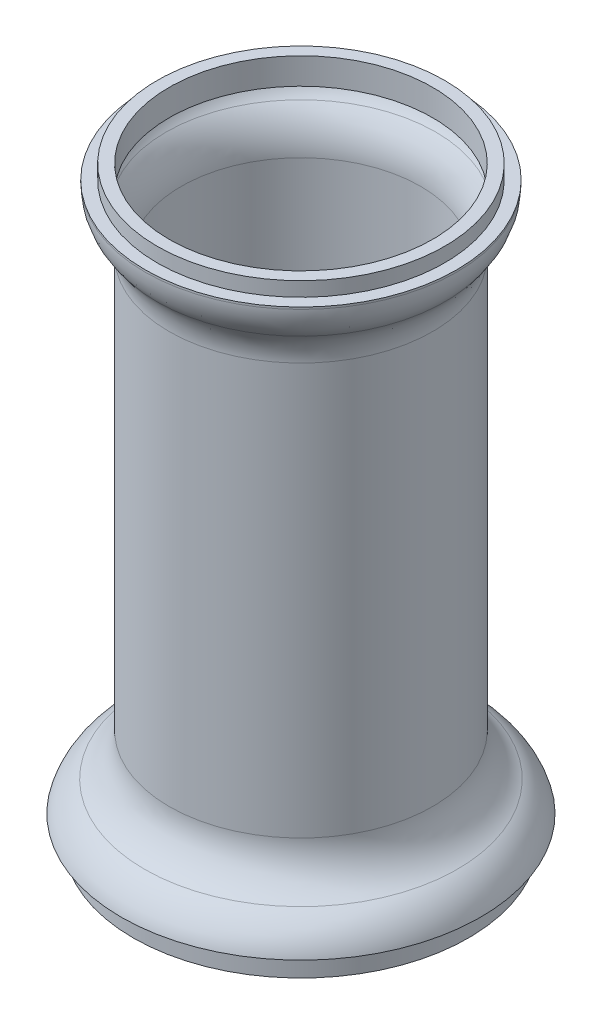
from build123d import *

# Parameters (mm, degrees)
SKETCH1_R           = 35
BOSS_EXTRUDE1_DEPTH = 5
SKETCH3_R           = 37.5
BOSS_EXTRUDE2_DEPTH = 5
SKETCH4_R           = 27.5
BOSS_EXTRUDE5_DEPTH = 104.5
SKETCH5_R           = 32.5
BOSS_EXTRUDE6_DEPTH = 5
SKETCH6_R           = 30
BOSS_EXTRUDE7_DEPTH = 3
FILLET1_R           = 10
FILLET2_R           = 10


# Read off the part's stored shape, not the designer's step: Shell1
with BuildPart() as part:
    # Sketch1 → Boss-Extrude1 (new body)
    with BuildSketch(Plane(origin=(0, 0, 0), x_dir=(1, 0, 0), z_dir=(0, 1, 0))):
        with Locations(Location((0, 0, 0), (0, 0, 270))):
            Circle(SKETCH1_R)
    extrude(amount=BOSS_EXTRUDE1_DEPTH)

    # Sketch3 → Boss-Extrude2 (add)
    with BuildSketch(Plane(origin=(0, 5, 0), x_dir=(1, 0, 0), z_dir=(0, 1, 0))):
        with Locations(Location((0, 0, 0), (0, 0, 270))):
            Circle(SKETCH3_R)
    extrude(amount=BOSS_EXTRUDE2_DEPTH)

    # Sketch4 → Boss-Extrude5 (add)
    with BuildSketch(Plane(origin=(0, 10, 0), x_dir=(1, 0, 0), z_dir=(0, 1, 0))):
        with Locations(Location((0, 0, 0), (0, 0, 270))):
            Circle(SKETCH4_R)
    extrude(amount=BOSS_EXTRUDE5_DEPTH)

    # Sketch5 → Boss-Extrude6 (add)
    with BuildSketch(Plane(origin=(0, 114.5, 0), x_dir=(1, 0, 0), z_dir=(0, 1, 0))):
        with Locations(Location((0, 0, 0), (0, 0, 270))):
            Circle(SKETCH5_R)
    extrude(amount=BOSS_EXTRUDE6_DEPTH)

    # Sketch6 → Boss-Extrude7 (add)
    with BuildSketch(Plane(origin=(0, 119.5, 0), x_dir=(1, 0, 0), z_dir=(0, 1, 0))):
        with Locations(Location((0, 0, 0), (0, 0, 270))):
            Circle(SKETCH6_R)
    extrude(amount=BOSS_EXTRUDE7_DEPTH)

    # Fillet1
    # the kernel refuses this fillet: 10 mm, written as the material it adds along each edge
    with BuildSketch(Plane(origin=(0, 10, 0), x_dir=(0, 0, 1), z_dir=(-1, 0, 0))) as fillet1_piece_1:
        with BuildLine():
            CenterArc((27.5 + FILLET1_R, FILLET1_R), FILLET1_R, 180, 90)
            Line((27.5 + FILLET1_R, 0), (27.5 + FILLET1_R, -FILLET1_R * 0.02))
            Line((27.5 + FILLET1_R, -FILLET1_R * 0.02), (27.5 - FILLET1_R * 0.02, -FILLET1_R * 0.02))
            Line((27.5 - FILLET1_R * 0.02, -FILLET1_R * 0.02), (27.5 - FILLET1_R * 0.02, FILLET1_R))
            Line((27.5 - FILLET1_R * 0.02, FILLET1_R), (27.5, FILLET1_R))
        make_face()
    revolve(axis=Axis((0, 10, 0), (0, 1, 0)))
    with BuildSketch(Plane(origin=(0, 114.5, 0), x_dir=(0, 0, 1), z_dir=(-1, 0, 0))) as fillet1_piece_2:
        with BuildLine():
            CenterArc((37.5, -8.660254038), FILLET1_R, 120, 60)
            Line((27.5, -8.660254038), (27.3, -8.660254038))
            Line((27.3, -8.660254038), (27.3, 0))
            Line((27.3, 0), (27.5, 0.2))
            ThreePointArc((27.5, 0.2), (30, 0.2), (32.4, 0.173205081))
            Line((32.4, 0.173205081), (32.5, 0))
        make_face()
    revolve(axis=Axis((0, 114.5, 0), (0, 1, 0)))

    # Fillet2
    # the kernel refuses this fillet: 10 mm, written as the material it takes off along each edge
    with BuildSketch(Plane(origin=(0, 114.5, 0), x_dir=(0, 0, 1), z_dir=(-1, 0, 0))) as fillet2_piece_1:
        with BuildLine():
            CenterArc((22.5, 4.568502517), FILLET2_R, 318.590377891, 41.409622109)
            Line((32.5, 4.568502517), (32.7, 4.568502517))
            Line((32.7, 4.568502517), (32.7, 0))
            Line((32.7, 0), (32.6, -0.173205081))
            ThreePointArc((32.6, -0.173205081), (31.293504258, -1.076098804), (30.15, -2.178163326))
            Line((30.15, -2.178163326), (30, -2.04587576))
        make_face()
    revolve(axis=Axis((0, 114.5, 0), (0, 1, 0)), mode=Mode.SUBTRACT)
    with BuildSketch(Plane(origin=(0, 10, 0), x_dir=(0, 0, 1), z_dir=(-1, 0, 0))) as fillet2_piece_2:
        with BuildLine():
            CenterArc((27.817541634, -7.5), FILLET2_R, 14.477512186, 46.567463442)
            Line((37.5, -5), (37.693649167, -4.95))
            ThreePointArc((37.693649167, -4.95), (37.7, -2.5), (37.7, 0))
            Line((37.7, 0), (37.5, 0.2))
            ThreePointArc((37.5, 0.2), (35.05, 0.511190802), (32.755595401, 1.425))
            Line((32.755595401, 1.425), (32.658770817, 1.25))
        make_face()
    revolve(axis=Axis((0, 10, 0), (0, 1, 0)), mode=Mode.SUBTRACT)

    # Shell1 outline → Shell1 (revolve, cut)
    with BuildSketch(Plane.XY):
        with BuildLine():
            ThreePointArc((28.125, 114.107718809), (29.07798837, 115.465716235), (29.709112104, 117))
            Line((29.709112104, 117), (27.5, 117))
            Line((27.5, 117), (27.5, 122.5))
            Line((27.5, 122.5), (0, 122.5))
            Line((0, 122.5), (0, 0))
            Line((0, 0), (32.5, 0))
            Line((32.5, 0), (32.5, 7.5))
            Line((32.5, 7.5), (33.407711578, 7.5))
            ThreePointArc((33.407711578, 7.5), (32.493809933, 8.363660529), (31.448463522, 9.0625))
            ThreePointArc((31.448463522, 9.0625), (26.732126348, 13.65154373), (25, 20))
            Line((25, 20), (25, 105.839745962))
            ThreePointArc((25, 105.839745962), (25.807320666, 110.259163345), (28.125, 114.107718809))
        make_face()
    revolve(axis=Axis((0, 0, 0), (0, 1, 0)), mode=Mode.SUBTRACT)


solid = part.part
